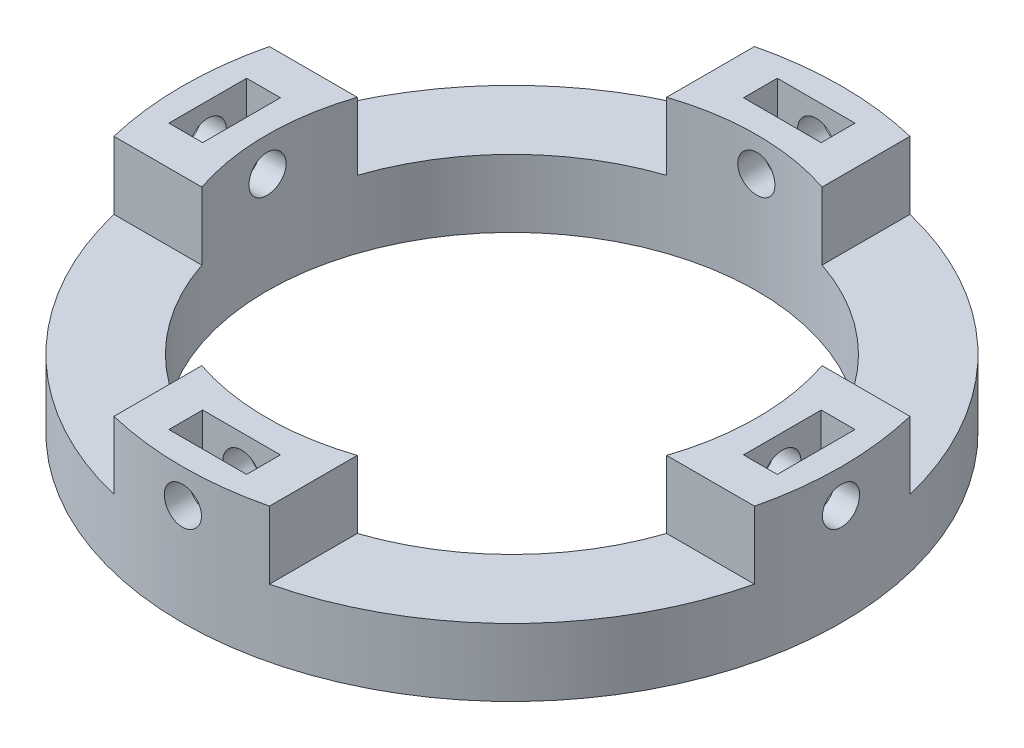
from build123d import *
from build123d.topology import SkipClean

# Parameters (mm, degrees)
SKETCH_1_R               = 19.5
SKETCH_1_R_2             = 14.5
EXTRUDE_1_DEPTH          = 4
SKETCH_3_W               = 4.6
SKETCH_3_H               = 2
SKETCH_3_W_2             = 2
SKETCH_3_H_2             = 4.6
EXTRUDE_3_DEPTH          = 4
SKETCH_12_R              = 1.1
CUT_EXTRUDE_2_DEPTH      = 44.017438324
PATTERN_CIRCULAR_2_COUNT = 2
PATTERN_CIRCULAR_2_ANGLE = 90


with BuildPart() as part:
    # Эскиз1 → Бобышка-Вытянуть1 (new body)
    with BuildSketch(Plane(origin=(0, 0, 0), x_dir=(1, 0, 0), z_dir=(0, 1, 0))):
        Circle(SKETCH_1_R)
        Circle(SKETCH_1_R_2, mode=Mode.SUBTRACT)
    extrude(amount=EXTRUDE_1_DEPTH)

    # Эскиз3 → Бобышка-Вытянуть3 (add)
    # profile 1 of 4: a face of its own
    with SkipClean():  # the faces are left unmerged after this step: merging them gives an invalid solid
        with BuildSketch(Plane(origin=(0, 4, 0), x_dir=(1, 0, 0), z_dir=(0, 1, 0))):
            with BuildLine():
                Line((-4.599991072, 18.949672349), (-4.599991072, 13.75100295))
                ThreePointArc((-4.599991072, 13.75100295), (0, 14.5), (4.599991072, 13.75100295))
                Line((4.599991072, 13.75100295), (4.599991072, 18.949672349))
                ThreePointArc((4.599991072, 18.949672349), (0, 19.5), (-4.599991072, 18.949672349))
            make_face()
            with Locations((0, 17)):
                Rectangle(SKETCH_3_W, SKETCH_3_H, mode=Mode.SUBTRACT)
        # profile 2 of 4: a face of its own
        with BuildSketch(Plane(origin=(0, 4, 0), x_dir=(1, 0, 0), z_dir=(0, 1, 0))):
            with BuildLine():
                Line((18.949672349, 4.599991072), (13.75100295, 4.599991072))
                ThreePointArc((13.75100295, 4.599991072), (14.5, 0), (13.75100295, -4.599991072))
                Line((13.75100295, -4.599991072), (18.949672349, -4.599991072))
                ThreePointArc((18.949672349, -4.599991072), (19.5, 0), (18.949672349, 4.599991072))
            make_face()
            with Locations((17, 0)):
                Rectangle(SKETCH_3_W_2, SKETCH_3_H_2, mode=Mode.SUBTRACT)
        # profile 3 of 4: a face of its own
        with BuildSketch(Plane(origin=(0, 4, 0), x_dir=(1, 0, 0), z_dir=(0, 1, 0))):
            with BuildLine():
                Line((4.599991072, -18.949672349), (4.599991072, -13.75100295))
                ThreePointArc((4.599991072, -13.75100295), (0, -14.5), (-4.599991072, -13.75100295))
                Line((-4.599991072, -13.75100295), (-4.599991072, -18.949672349))
                ThreePointArc((-4.599991072, -18.949672349), (0, -19.5), (4.599991072, -18.949672349))
            make_face()
            with Locations((0, -17)):
                Rectangle(SKETCH_3_W, SKETCH_3_H, mode=Mode.SUBTRACT)
        # profile 4 of 4: a face of its own
        with BuildSketch(Plane(origin=(0, 4, 0), x_dir=(1, 0, 0), z_dir=(0, 1, 0))):
            with BuildLine():
                Line((-18.949672349, -4.599991072), (-13.75100295, -4.599991072))
                ThreePointArc((-13.75100295, -4.599991072), (-14.5, 0), (-13.75100295, 4.599991072))
                Line((-13.75100295, 4.599991072), (-18.949672349, 4.599991072))
                ThreePointArc((-18.949672349, 4.599991072), (-19.5, 0), (-18.949672349, -4.599991072))
            make_face()
            with Locations((-17, 0)):
                Rectangle(SKETCH_3_W_2, SKETCH_3_H_2, mode=Mode.SUBTRACT)
        extrude(amount=EXTRUDE_3_DEPTH)

    # Эскиз12 → Вырез-Вытянуть2 (cut, symmetric)
    with SkipClean():  # the faces are left unmerged after this step: merging them gives an invalid solid
        with BuildSketch(Plane.XY.offset(-18)):
            with Locations((0, 6)):
                Circle(SKETCH_12_R)
        cut_extrude_2 = extrude(amount=CUT_EXTRUDE_2_DEPTH, both=True, mode=Mode.SUBTRACT)

    # Круговой массив2: Вырез-Вытянуть2 ×2 about axis
    with SkipClean():  # the faces are left unmerged after this step: merging them gives an invalid solid
        pattern_circular_2_axis = Axis((0, 4, 0), (0, -1, 0))
        for i in range(1, PATTERN_CIRCULAR_2_COUNT):
            add(cut_extrude_2.rotate(pattern_circular_2_axis, i * PATTERN_CIRCULAR_2_ANGLE / (PATTERN_CIRCULAR_2_COUNT - 1)), mode=Mode.SUBTRACT)


solid = part.part
